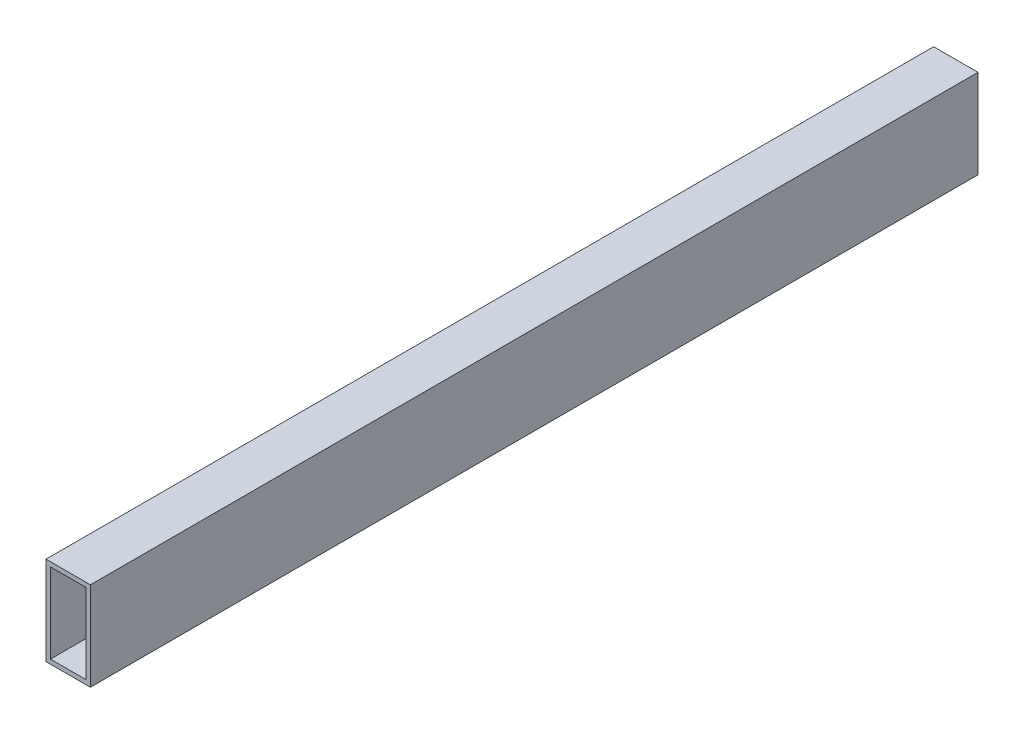
from build123d import *

# Parameters (mm, degrees)
SKETCH1_W           = 25.4
SKETCH1_H           = 50.8
SKETCH1_W_2         = 20.32
SKETCH1_H_2         = 45.72
EXTRUDE_THIN1_DEPTH = 508


with BuildPart() as part:
    # Sketch1 → Extrude-Thin1 (new body)
    with BuildSketch(Plane.XY):
        Rectangle(SKETCH1_W, SKETCH1_H)
        Rectangle(SKETCH1_W_2, SKETCH1_H_2, mode=Mode.SUBTRACT)
    extrude(amount=EXTRUDE_THIN1_DEPTH)


solid = part.part
